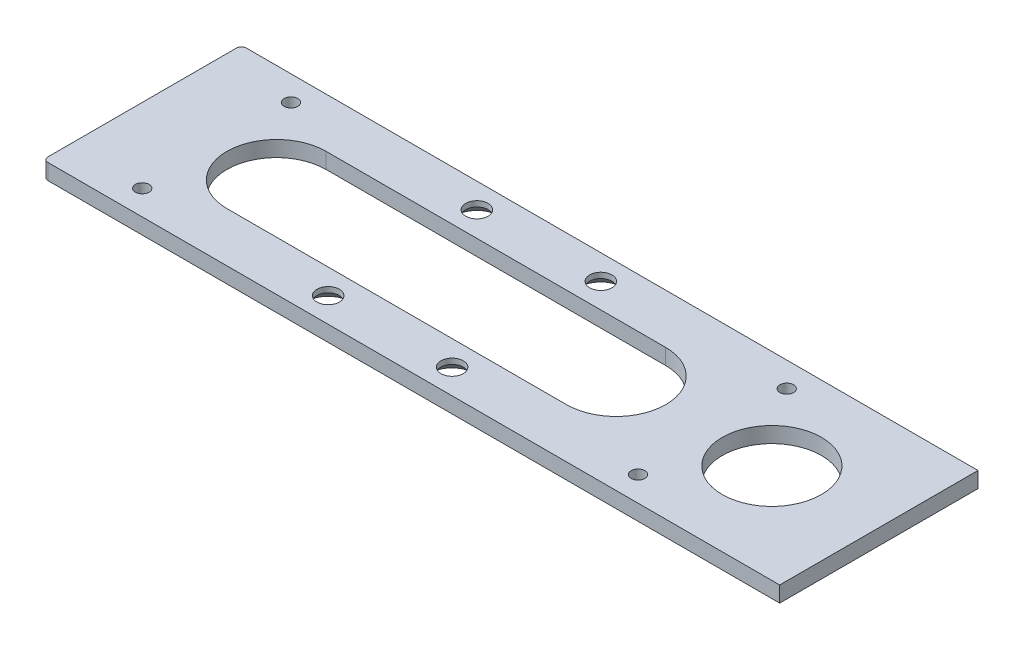
from build123d import *

# Parameters (mm, degrees)
CROQUIS1_W                                      = 297.15
CROQUIS1_H                                      = 80
BRIDA_BASE1_DEPTH                               = 6.35
REDONDEO1_R                                     = 2
TALADRO_DE_MARGEN_PARA_M51_D                    = 5.5
CROQUIS9_R                                      = 20
CORTAR_EXTRUIR1_DEPTH                           = 10
CSK_FOR_M8_OVAL_HEAD_MACHINE_SCREW1_D           = 9
CSK_FOR_M8_OVAL_HEAD_MACHINE_SCREW1_CSINK_D     = 17.3
CSK_FOR_M8_OVAL_HEAD_MACHINE_SCREW1_CSINK_ANGLE = 90


# Sheet-metal steps are written as plain solids
with BuildPart() as part:
    # Croquis1 → Brida base1 (new body)
    with BuildSketch(Plane(origin=(0, 0, 0), x_dir=(1, 0, 0), z_dir=(0, 1, 0))):
        with Locations((-1.202777778, -5.555555556)):
            Rectangle(CROQUIS1_W, CROQUIS1_H)
    extrude(amount=-BRIDA_BASE1_DEPTH)

    # Redondeo1
    redondeo1_edges = [part.edges().sort_by_distance(p)[0] for p in [
        (-149.777777778, -3.175, -34.444444444),
        (-149.777777778, -3.175, 45.555555556),
    ]]
    fillet(redondeo1_edges, radius=REDONDEO1_R)

    # Taladro de margen para M51 (through all)
    with Locations(Plane(origin=(0, 0, 0), x_dir=(1, 0, 0), z_dir=(0, 1, 0))):
        with Locations((-119.777777778, 24.444444444), (-119.777777778, -35.555555556), (80.222222222, -35.555555556), (80.222222222, 24.444444444)):
            Hole(TALADRO_DE_MARGEN_PARA_M51_D / 2)

    # Croquis9 → Cortar-Extruir1 (cut)
    with BuildSketch(Plane(origin=(0, -6.35, 0), x_dir=(-1, 0, 0), z_dir=(0, -1, 0))):
        with Locations(Location((-104.209895864, -5.555555556, 0), (0, 0, 90))):
            Circle(CROQUIS9_R)
        with BuildLine():
            Line((-41.389105309, 14.444444444), (95.628093505, 14.444444444))
            ThreePointArc((95.628093505, 14.444444444), (115.628093505, -5.555555556), (95.628093505, -25.555555556))
            Line((95.628093505, -25.555555556), (-41.389105309, -25.555555556))
            ThreePointArc((-41.389105309, -25.555555556), (-61.389105309, -5.555555556), (-41.389105309, 14.444444444))
        make_face()
    extrude(amount=-CORTAR_EXTRUIR1_DEPTH, mode=Mode.SUBTRACT)

    # CSK for M8 Oval Head Machine Screw1 (through all)
    with Locations(Plane(origin=(-44.777777778, -6.35, -24.444444444), x_dir=(0, 0, -1), z_dir=(0, -1, 0))):
        with Locations((0, 0), (0, 50), (-60, 50), (-60, 0)):
            CounterSinkHole(CSK_FOR_M8_OVAL_HEAD_MACHINE_SCREW1_D / 2, CSK_FOR_M8_OVAL_HEAD_MACHINE_SCREW1_CSINK_D / 2, counter_sink_angle=CSK_FOR_M8_OVAL_HEAD_MACHINE_SCREW1_CSINK_ANGLE)


solid = part.part
